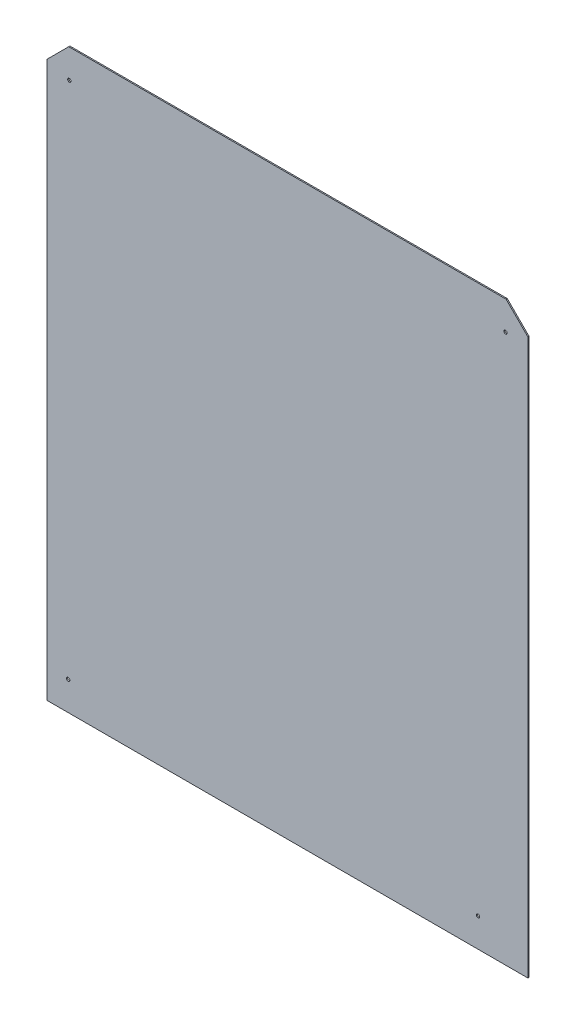
from build123d import *

# Parameters (mm, degrees)
BASE_FLANGE1_DEPTH = 1.4
CUT_EXTRUDE1_REACH = 900.18
SKETCH6_R          = 2


# Sheet-metal steps are written as plain solids
with BuildPart() as part:
    # Sketch1 → Base-Flange1 (new body)
    with BuildSketch(Plane.XY):
        Polygon((0, 664), (26, 690), (549, 690), (575, 664), (575, 0), (0, 0), align=None)
    extrude(amount=-BASE_FLANGE1_DEPTH)

    # Sketch6 → Cut-Extrude1 (cut, up to next)
    with BuildSketch(Plane.XY, mode=Mode.PRIVATE) as cut_extrude1_sk1:
        with Locations((26.7, 655.5)):
            Circle(SKETCH6_R)
    cut_extrude1_tool1 = extrude(cut_extrude1_sk1.sketch, amount=-CUT_EXTRUDE1_REACH, mode=Mode.PRIVATE) & part.part
    # Sketch6 → Cut-Extrude1 (cut, up to next)
    with BuildSketch(Plane.XY, mode=Mode.PRIVATE) as cut_extrude1_sk2:
        with Locations((548.3, 655.5)):
            Circle(SKETCH6_R)
    cut_extrude1_tool2 = extrude(cut_extrude1_sk2.sketch, amount=-CUT_EXTRUDE1_REACH, mode=Mode.PRIVATE) & part.part
    # Sketch6 → Cut-Extrude1 (cut, up to next)
    with BuildSketch(Plane.XY, mode=Mode.PRIVATE) as cut_extrude1_sk3:
        with Locations((25.3, 34.5)):
            Circle(SKETCH6_R)
    cut_extrude1_tool3 = extrude(cut_extrude1_sk3.sketch, amount=-CUT_EXTRUDE1_REACH, mode=Mode.PRIVATE) & part.part
    # Sketch6 → Cut-Extrude1 (cut, up to next)
    with BuildSketch(Plane.XY, mode=Mode.PRIVATE) as cut_extrude1_sk4:
        with Locations((515.5, 34.5)):
            Circle(SKETCH6_R)
    cut_extrude1_tool4 = extrude(cut_extrude1_sk4.sketch, amount=-CUT_EXTRUDE1_REACH, mode=Mode.PRIVATE) & part.part
    add(cut_extrude1_tool1.solids().sort_by_distance((26.7, 655.5, 0))[0], mode=Mode.SUBTRACT)
    add(cut_extrude1_tool2.solids().sort_by_distance((548.3, 655.5, 0))[0], mode=Mode.SUBTRACT)
    add(cut_extrude1_tool3.solids().sort_by_distance((25.3, 34.5, 0))[0], mode=Mode.SUBTRACT)
    add(cut_extrude1_tool4.solids().sort_by_distance((515.5, 34.5, 0))[0], mode=Mode.SUBTRACT)


solid = part.part
